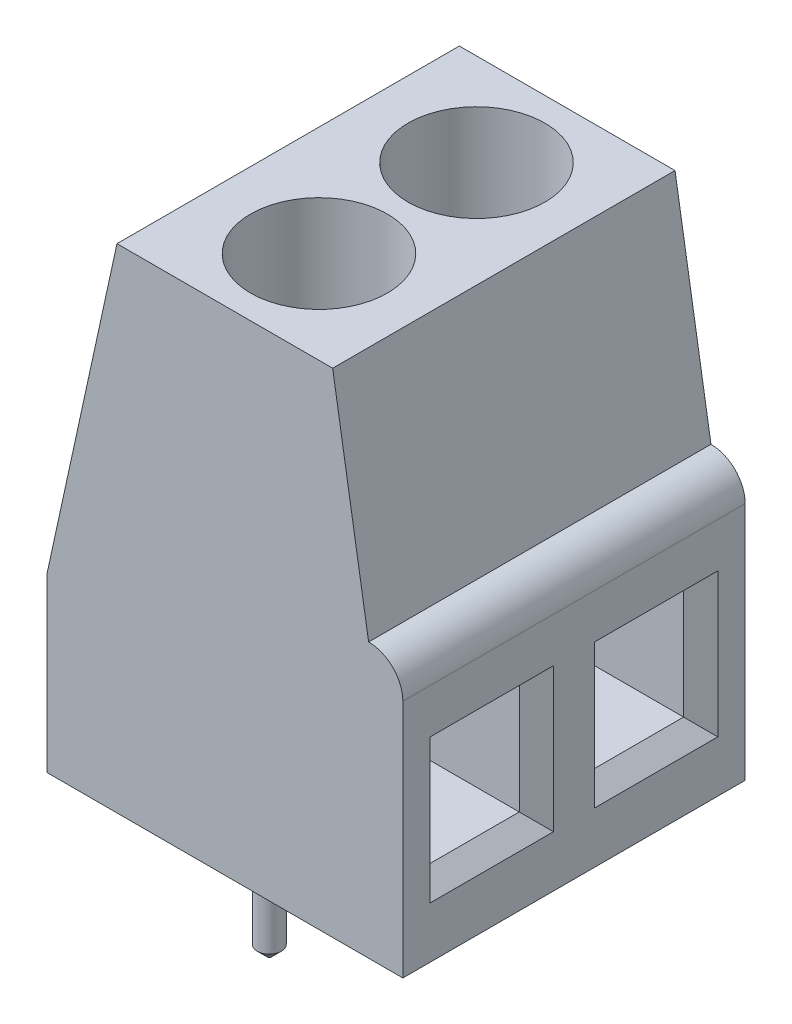
from build123d import *

# Parameters (mm, degrees)
RESSALTO_EXTRUS_O2_DEPTH = 10
ESBO_O4_W                = 2.6
ESBO_O4_H                = 3.2
CORTE_EXTRUS_O1_DEPTH    = 5
CHANFRO2_SIZE            = 0.5
CHANFRO3_SIZE            = 0.5
ESBO_O5_R                = 2
CORTE_EXTRUS_O2_DEPTH    = 3
ESBO_O10_R               = 0.35
RESSALTO_EXTRUS_O5_DEPTH = 3.6
CHANFRO4_SIZE            = 0.3


with BuildPart() as part:
    # Esboço2 → Ressalto-extrusão2 (new body)
    with BuildSketch(Plane.XY):
        with BuildLine():
            Line((0, 0), (10.4, 0))
            Line((10.4, 0), (10.4, 7))
            ThreePointArc((10.4, 7), (10.107106781, 7.707106781), (9.4, 8))
            Line((9.4, 8), (8.35, 14.4))
            Line((8.35, 14.4), (5.2, 14.4))
            Line((5.2, 14.4), (2.05, 14.4))
            Line((2.05, 14.4), (0, 5))
            Line((0, 5), (0, 0))
        make_face()
    extrude(amount=-RESSALTO_EXTRUS_O2_DEPTH)

    # Esboço4 → Corte-extrusão1 (cut)
    with BuildSketch(Plane(origin=(10.4, 0, 0), x_dir=(0, 0, -1), z_dir=(1, 0, 0))):
        with Locations((2.6, 3.6)):
            Rectangle(ESBO_O4_W, ESBO_O4_H)
        with Locations((7.4, 3.6)):
            Rectangle(ESBO_O4_W, ESBO_O4_H)
    extrude(amount=-CORTE_EXTRUS_O1_DEPTH, mode=Mode.SUBTRACT)

    # Chanfro2
    chanfro2_edges = [part.edges().sort_by_distance(p)[0] for p in [
        (10.4, 2, -2.6),
        (10.4, 3.6, -3.9),
        (10.4, 5.2, -2.6),
        (10.4, 3.6, -1.3),
    ]]
    chamfer(chanfro2_edges, length=CHANFRO2_SIZE)

    # Chanfro3
    chanfro3_edges = [part.edges().sort_by_distance(p)[0] for p in [
        (10.4, 3.6, -6.1),
        (10.4, 2, -7.4),
        (10.4, 3.6, -8.7),
        (10.4, 5.2, -7.4),
    ]]
    chamfer(chanfro3_edges, length=CHANFRO3_SIZE)

    # Esboço5 → Corte-extrusão2 (cut)
    with BuildSketch(Plane(origin=(0, 14.4, 0), x_dir=(1, 0, 0), z_dir=(0, 1, 0))):
        with Locations((5.25, 2.7)):
            Circle(ESBO_O5_R)
        with Locations((5.25, 7.3)):
            Circle(ESBO_O5_R)
    extrude(amount=-CORTE_EXTRUS_O2_DEPTH, mode=Mode.SUBTRACT)

    # Esboço10 → Ressalto-extrusão5 (add)
    with BuildSketch(Plane.XZ):
        with Locations((4.3, -2.2)):
            Circle(ESBO_O10_R)
        with Locations((4.3, -7.8)):
            Circle(ESBO_O10_R)
    extrude(amount=RESSALTO_EXTRUS_O5_DEPTH)

    # Chanfro4
    chanfro4_edges = [part.edges().sort_by_distance(p)[0] for p in [
        (3.95, -3.6, -7.8),
        (3.95, -3.6, -2.2),
    ]]
    chamfer(chanfro4_edges, length=CHANFRO4_SIZE)


solid = part.part
